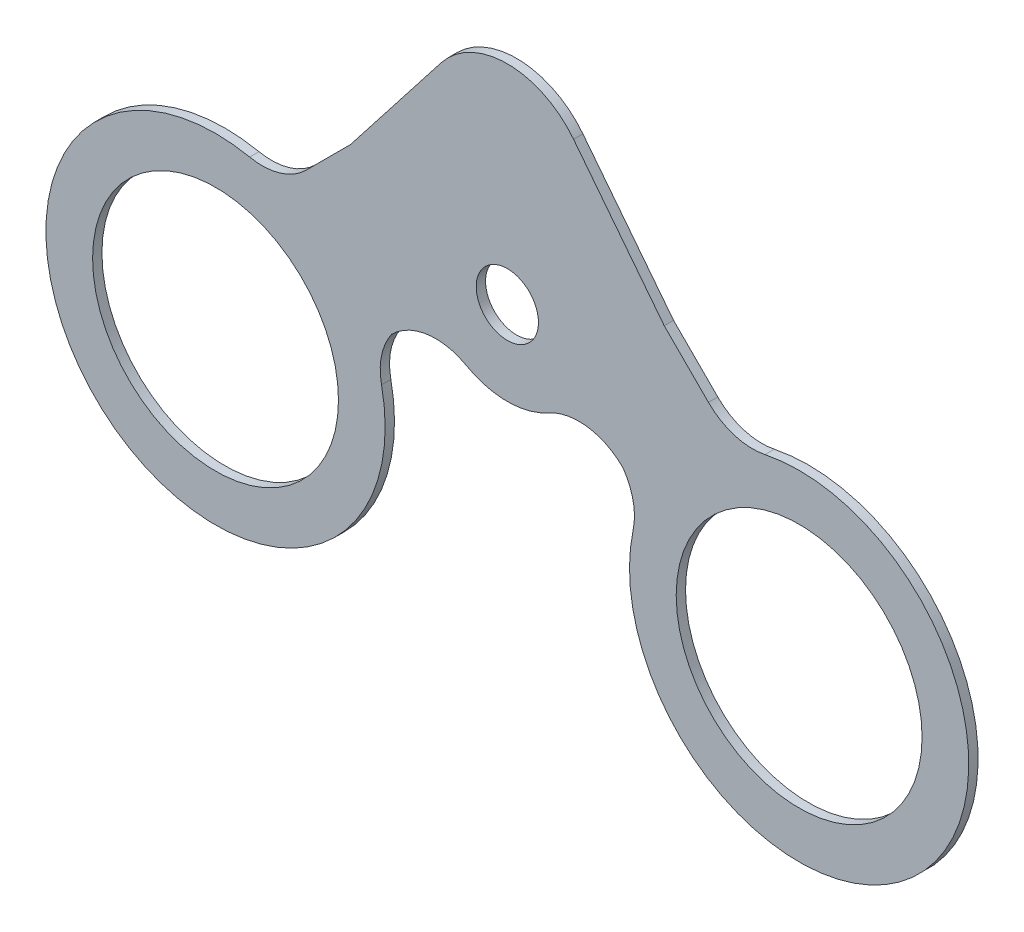
from build123d import *

# Parameters (mm, degrees)
SKETCH_1_R      = 39.5
SKETCH_1_R_2    = 10
EXTRUDE_1_DEPTH = 3
FILLET_1_R      = 20
FILLET_2_R      = 20


with BuildPart() as part:
    # Эскиз1 → Бобышка-Вытянуть1 (new body)
    with BuildSketch(Plane.XY):
        with BuildLine():
            Line((-73.038609064, 50.411192066), (-50.411192066, 73.038609064))
            Line((-50.411192066, 73.038609064), (-21.285640845, 110.360884799))
            ThreePointArc((-21.285640845, 110.360884799), (0, 120.75), (21.285640845, 110.360884799))
            Line((21.285640845, 110.360884799), (50.411192066, 73.038609064))
            Line((50.411192066, 73.038609064), (73.038609064, 50.411192066))
            ThreePointArc((73.038609064, 50.411192066), (132.287319575, -38.537319575), (43.338807934, 20.711390936))
            Line((43.338807934, 20.711390936), (23.534235961, 40.515962909))
            ThreePointArc((23.534235961, 40.515962909), (0, 26.75), (-23.534235961, 40.515962909))
            Line((-23.534235961, 40.515962909), (-43.338807934, 20.711390936))
            ThreePointArc((-43.338807934, 20.711390936), (-132.287319575, -38.537319575), (-73.038609064, 50.411192066))
        make_face()
        with Locations((-93.75, 0)):
            Circle(SKETCH_1_R, mode=Mode.SUBTRACT)
        with Locations((93.75, 0)):
            Circle(SKETCH_1_R, mode=Mode.SUBTRACT)
        with Locations((0, 53.75)):
            Circle(SKETCH_1_R_2, mode=Mode.SUBTRACT)
    extrude(amount=EXTRUDE_1_DEPTH)

    # Скругление1
    fillet_1_edges = [part.edges().sort_by_distance(p)[0] for p in [
        (23.534235961, 40.515962909, 1.5),
        (-23.534235961, 40.515962909, 1.5),
    ]]
    fillet(fillet_1_edges, radius=FILLET_1_R)

    # Скругление2
    # the kernel refuses this fillet: 20 mm, written as the material it adds along each edge
    with BuildSketch(Plane(origin=(73.038609064, 50.411192066, 0), x_dir=(0.9564465824657693, 0.29190740807583243, 0), z_dir=(0, 0, 1))) as fillet_2_piece_1:
        with BuildLine():
            CenterArc((12.057212621, 19.912448006), FILLET_2_R, 208.027815678, 56.6091051)
            Line((-5.59717882, 10.514444874), (-5.950266649, 10.326484811))
            Line((-5.950266649, 10.326484811), (-0.353087829, -0.187960063))
            Line((-0.353087829, -0.187960063), (0.037386706, -0.39824896))
            ThreePointArc((0.037386706, -0.39824896), (5.093938665, -0.161420815), (10.150490625, -0.39824896))
            Line((10.150490625, -0.39824896), (10.187877331, 0))
        make_face()
    extrude(amount=3)
    with BuildSketch(Plane(origin=(-73.038609064, 50.411192066, 0), x_dir=(-0.9564465824657701, 0.2919074080758299, 0), z_dir=(0, 0, 1))) as fillet_2_piece_2:
        with BuildLine():
            CenterArc((12.057212621, -19.912448006), FILLET_2_R, 95.363079222, 56.6091051)
            Line((-5.59717882, -10.514444874), (-5.950266649, -10.326484811))
            Line((-5.950266649, -10.326484811), (-0.353087829, 0.187960063))
            Line((-0.353087829, 0.187960063), (0.037386706, 0.39824896))
            ThreePointArc((0.037386706, 0.39824896), (5.093938665, 0.161420815), (10.150490625, 0.39824896))
            Line((10.150490625, 0.39824896), (10.187877331, 0))
        make_face()
    extrude(amount=3)
    with BuildSketch(Plane(origin=(43.338807934, 20.711390936, 0), x_dir=(-0.7071067811865486, 0.7071067811865466, 0), z_dir=(0, 0, 1))) as fillet_2_piece_3:
        with BuildLine():
            CenterArc((12.095099349, 19.719973869), FILLET_2_R, 213.13333953, 47.267573146)
            Line((-4.652916781, 8.788187386), (-4.987877104, 8.569551657))
            ThreePointArc((-4.987877104, 8.569551657), (-2.479115111, 4.313269402), (-0.369110171, -0.154135272))
            Line((-0.369110171, -0.154135272), (0, -0.4))
            ThreePointArc((0, -0.4), (4.380019269, -0.4), (8.693337321, -0.394399477))
            Line((8.693337321, -0.394399477), (8.760038538, 0))
        make_face()
    extrude(amount=3)
    with BuildSketch(Plane(origin=(-43.338807934, 20.711390936, 0), x_dir=(0.7071067811865474, 0.7071067811865477, 0), z_dir=(0, 0, 1))) as fillet_2_piece_4:
        with BuildLine():
            CenterArc((12.095099349, -19.719973869), FILLET_2_R, 99.599087325, 47.267573146)
            Line((-4.652916781, -8.788187386), (-4.987877104, -8.569551657))
            ThreePointArc((-4.987877104, -8.569551657), (-2.479115111, -4.313269402), (-0.369110171, 0.154135272))
            Line((-0.369110171, 0.154135272), (0, 0.4))
            ThreePointArc((0, 0.4), (4.380019269, 0.4), (8.693337321, 0.394399477))
            Line((8.693337321, 0.394399477), (8.760038538, 0))
        make_face()
    extrude(amount=3)


solid = part.part
